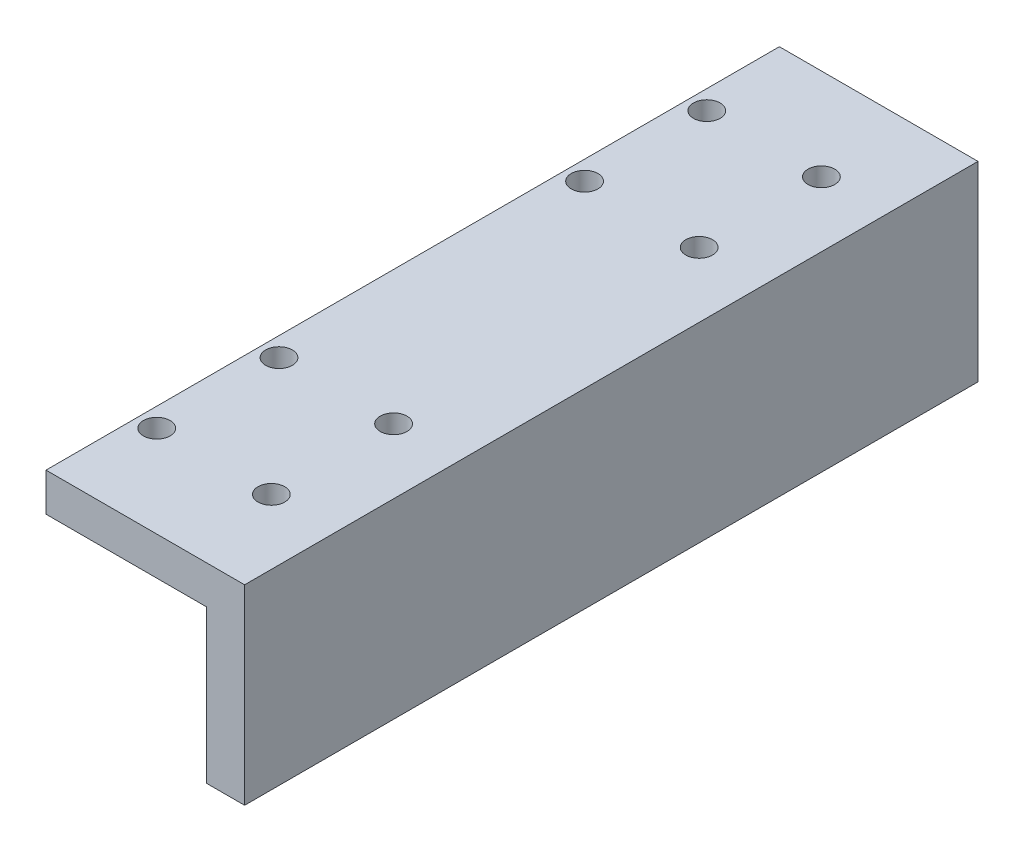
from build123d import *

# Parameters (mm, degrees)
SKETCH1_R           = 1.75
BOSS_EXTRUDE1_DEPTH = 5
SKETCH2_W           = 96
SKETCH2_H           = 25
BOSS_EXTRUDE2_DEPTH = 5


with BuildPart() as part:
    # Sketch1 → Boss-Extrude1 (new body)
    with BuildSketch(Plane(origin=(0, 0, 0), x_dir=(1, 0, 0), z_dir=(0, 1, 0))):
        Polygon((-10, 48), (10, 48), (11, 48), (11, -48), (10, -48), (-10, -48), align=None)
        with Locations((-7.5, 36)):
            Circle(SKETCH1_R, mode=Mode.SUBTRACT)
        with Locations((7.5, 36)):
            Circle(SKETCH1_R, mode=Mode.SUBTRACT)
        with Locations((-7.5, 20)):
            Circle(SKETCH1_R, mode=Mode.SUBTRACT)
        with Locations((7.5, 20)):
            Circle(SKETCH1_R, mode=Mode.SUBTRACT)
        with Locations((7.5, -20)):
            Circle(SKETCH1_R, mode=Mode.SUBTRACT)
        with Locations((-7.5, -20)):
            Circle(SKETCH1_R, mode=Mode.SUBTRACT)
        with Locations((7.5, -36)):
            Circle(SKETCH1_R, mode=Mode.SUBTRACT)
        with Locations((-7.5, -36)):
            Circle(SKETCH1_R, mode=Mode.SUBTRACT)
    extrude(amount=BOSS_EXTRUDE1_DEPTH)

    # Sketch2 → Boss-Extrude2 (add)
    with BuildSketch(Plane(origin=(11, 0, 0), x_dir=(0, 0, -1), z_dir=(1, 0, 0))):
        with Locations((0, -7.5)):
            Rectangle(SKETCH2_W, SKETCH2_H)
    extrude(amount=BOSS_EXTRUDE2_DEPTH)


solid = part.part
